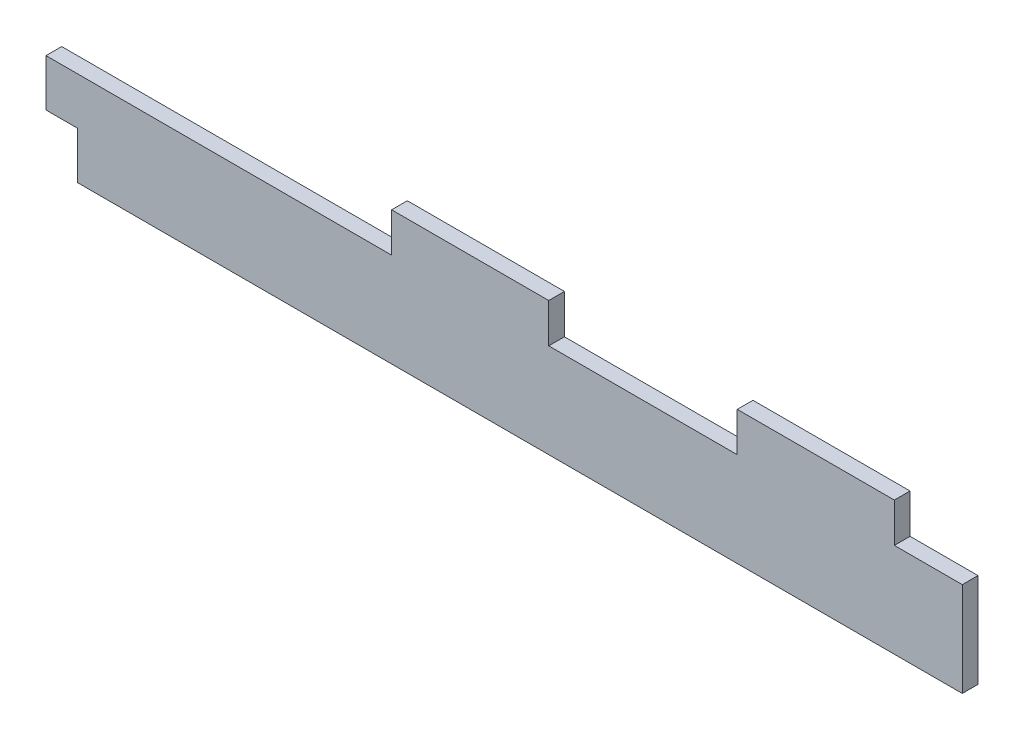
from build123d import *

# Parameters (mm, degrees)
BASE_FLANGE1_DEPTH = 2


# Sheet-metal steps are written as plain solids
with BuildPart() as part:
    # Sketch1 → Base-Flange1 (new body)
    with BuildSketch(Plane.XY):
        Polygon((49, 15), (73, 15), (73, 20), (93, 20), (93, 15), (101.65, 15), (101.65, 3), (-11, 3), (-11, 9), (-15, 9), (-15, 15), (29, 15), (29, 20), (49, 20), align=None)
    extrude(amount=-BASE_FLANGE1_DEPTH)


solid = part.part
